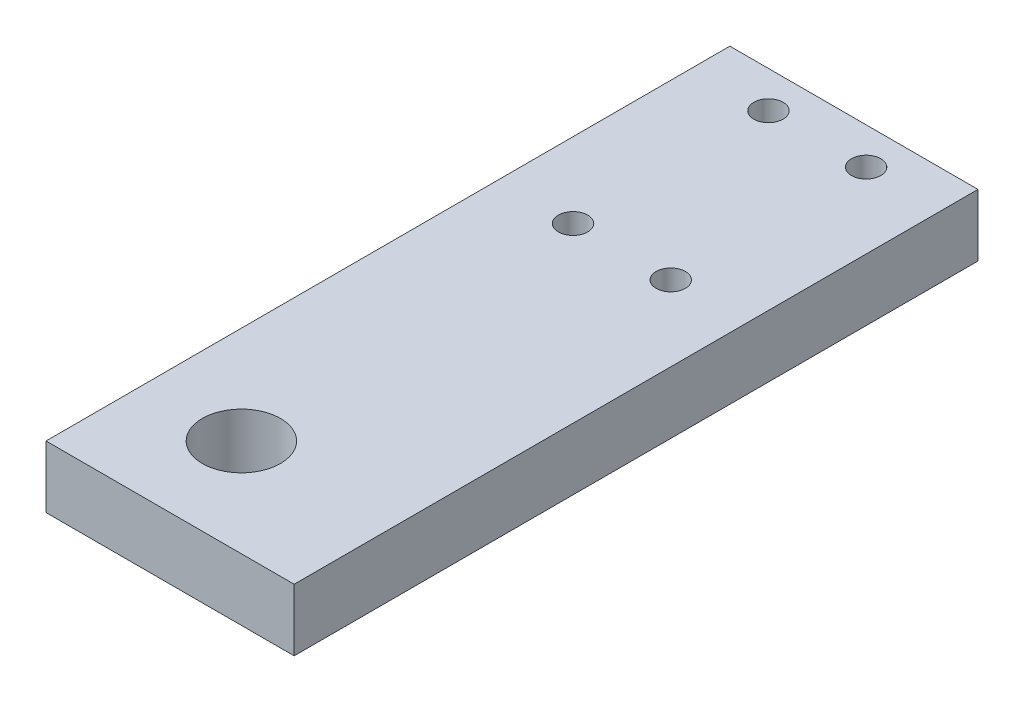
from build123d import *

# Parameters (mm, degrees)
SKETCH2_W           = 101.6
SKETCH2_H           = 280
BOSS_EXTRUDE1_DEPTH = 25.4
SKETCH3_R           = 6
CUT_EXTRUDE1_DEPTH  = 25.4
SKETCH4_R           = 16
CUT_EXTRUDE2_DEPTH  = 25.4


with BuildPart() as part:
    # Sketch2 → Boss-Extrude1 (new body)
    with BuildSketch(Plane(origin=(0, 0, 0), x_dir=(1, 0, 0), z_dir=(0, 1, 0))):
        with Locations((50.8, 140)):
            Rectangle(SKETCH2_W, SKETCH2_H)
    extrude(amount=BOSS_EXTRUDE1_DEPTH)

    # Sketch3 → Cut-Extrude1 (cut)
    with BuildSketch(Plane(origin=(0, 25.4, 0), x_dir=(1, 0, 0), z_dir=(0, 1, 0))):
        with Locations((70.8, 265)):
            Circle(SKETCH3_R)
        with Locations((30.8, 265)):
            Circle(SKETCH3_R)
        with Locations((30.8, 185)):
            Circle(SKETCH3_R)
        with Locations((70.8, 185)):
            Circle(SKETCH3_R)
    extrude(amount=-CUT_EXTRUDE1_DEPTH, mode=Mode.SUBTRACT)

    # Sketch4 → Cut-Extrude2 (cut)
    with BuildSketch(Plane(origin=(0, 25.4, 0), x_dir=(1, 0, 0), z_dir=(0, 1, 0))):
        with Locations((40, 40)):
            Circle(SKETCH4_R)
    extrude(amount=-CUT_EXTRUDE2_DEPTH, mode=Mode.SUBTRACT)


solid = part.part
